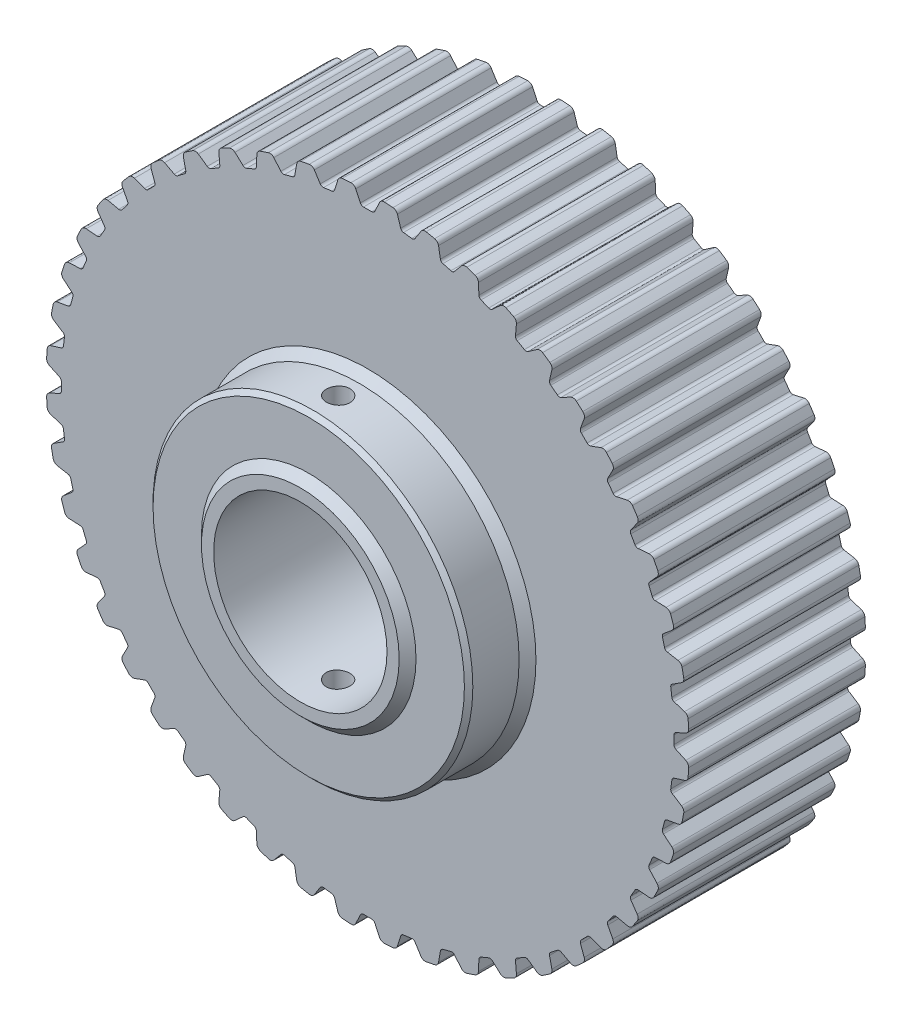
from build123d import *

# Parameters (mm, degrees)
SKETCH1_R                = 38.197185
BOSS_EXTRUDE1_DEPTH      = 21
SKETCH2_R                = 19
BOSS_EXTRUDE2_DEPTH      = 7
SKETCH3_R                = 10.3
CUT_EXTRUDE1_DEPTH       = 61.844472911
CUT_EXTRUDE2_DEPTH       = 58.957310875
FILLET1_R                = 0.4
FILLET2_R                = 0.6
CIRPATTERN1_COUNT        = 48
FILLET1_OF_CIRPATTERN1_R = 0.4
FILLET2_OF_CIRPATTERN1_R = 0.6
BOSS_EXTRUDE3_START      = 1
SKETCH6_R                = 11.75
SKETCH6_R_2              = 10.3
BOSS_EXTRUDE3_DEPTH      = 1
CHAMFER1_SIZE            = 1
CHAMFER2_SIZE            = 1
SKETCH9_R                = 1.4
CUT_EXTRUDE5_DEPTH       = 20
CHAMFER3_SIZE            = 0.5


with BuildPart() as part:
    # Sketch1 → Boss-Extrude1 (new body)
    with BuildSketch(Plane.XY):
        with Locations(Location((0, 0, 0), (0, 0, 180))):
            Circle(SKETCH1_R)
    extrude(amount=BOSS_EXTRUDE1_DEPTH)

    # Sketch2 → Boss-Extrude2 (add)
    with BuildSketch(Plane.XY.offset(21)):
        Circle(SKETCH2_R)
    extrude(amount=BOSS_EXTRUDE2_DEPTH)

    # Sketch3 → Cut-Extrude1 (cut, through all)
    with BuildSketch(Plane.XY.offset(28)):
        Circle(SKETCH3_R)
    extrude(amount=-CUT_EXTRUDE1_DEPTH, mode=Mode.SUBTRACT)

    # Sketch4 → Cut-Extrude2 (cut, through all)
    with BuildSketch(Plane.XY.offset(21)):
        with BuildLine():
            Line((-1.592957441, 38.197185), (-0.75, 36.389456934))
            ThreePointArc((-0.75, 36.389456934), (0, 36.397185), (0.75, 36.389456934))
            Line((0.75, 36.389456934), (1.592957441, 38.197185))
            Line((1.592957441, 38.197185), (-1.592957441, 38.197185))
        make_face()
    cut_extrude2 = extrude(amount=-CUT_EXTRUDE2_DEPTH, mode=Mode.SUBTRACT)

    # Fillet1
    fillet1_edges = [part.edges().sort_by_distance(p)[0] for p in [
        (-0.75, 36.389456934, 10.5),
        (0.75, 36.389456934, 10.5),
    ]]
    fillet(fillet1_edges, radius=FILLET1_R)

    # Fillet2
    fillet2_edges = [part.edges().sort_by_distance(p)[0] for p in [
        (1.577756293, 38.164586032, 10.5),
        (-1.577756293, 38.164586032, 10.5),
    ]]
    fillet(fillet2_edges, radius=FILLET2_R)

    # CirPattern1: Cut-Extrude2 ×48 about axis
    cirpattern1_axis = Axis((0, 0, 0), (0, 0, 1))
    for i in range(1, CIRPATTERN1_COUNT):
        add(cut_extrude2.rotate(cirpattern1_axis, i * 360 / CIRPATTERN1_COUNT), mode=Mode.SUBTRACT)

    # Fillet1 of CirPattern1
    fillet1_of_cirpattern1_edges = [part.edges().sort_by_distance(p)[0] for p in [
        (-5.493360897, 35.980245441, 10.5),
        (-4.006193604, 36.176034729, 10.5),
        (-10.142728865, 34.955401973, 10.5),
        (-8.693840126, 35.343630541, 10.5),
        (-14.618551931, 33.332461886, 10.5),
        (-13.232732632, 33.906487034, 10.5),
        (-18.84424752, 31.139194134, 10.5),
        (-17.545209414, 31.889194134, 10.5),
        (-22.747512809, 28.413126138, 10.5),
        (-21.557482799, 29.326268281, 10.5),
        (-26.261561847, 25.200901676, 10.5),
        (-25.200901676, 26.261561847, 10.5),
        (-29.326268281, 21.557482799, 10.5),
        (-28.413126138, 22.747512809, 10.5),
        (-31.889194134, 17.545209414, 10.5),
        (-31.139194134, 18.84424752, 10.5),
        (-33.906487034, 13.232732632, 10.5),
        (-33.332461886, 14.618551931, 10.5),
        (-35.343630541, 8.693840126, 10.5),
        (-34.955401973, 10.142728865, 10.5),
        (-36.176034729, 4.006193604, 10.5),
        (-35.980245441, 5.493360897, 10.5),
        (-36.389456934, -0.75, 10.5),
        (-36.389456934, 0.75, 10.5),
        (-35.980245441, -5.493360897, 10.5),
        (-36.176034729, -4.006193604, 10.5),
        (-34.955401973, -10.142728865, 10.5),
        (-35.343630541, -8.693840126, 10.5),
        (-33.332461886, -14.618551931, 10.5),
        (-33.906487034, -13.232732632, 10.5),
        (-31.139194134, -18.84424752, 10.5),
        (-31.889194134, -17.545209414, 10.5),
        (-28.413126138, -22.747512809, 10.5),
        (-29.326268281, -21.557482799, 10.5),
        (-25.200901676, -26.261561847, 10.5),
        (-26.261561847, -25.200901676, 10.5),
        (-21.557482799, -29.326268281, 10.5),
        (-22.747512809, -28.413126138, 10.5),
        (-17.545209414, -31.889194134, 10.5),
        (-18.84424752, -31.139194134, 10.5),
        (-13.232732632, -33.906487034, 10.5),
        (-14.618551931, -33.332461886, 10.5),
        (-8.693840126, -35.343630541, 10.5),
        (-10.142728865, -34.955401973, 10.5),
        (-4.006193604, -36.176034729, 10.5),
        (-5.493360897, -35.980245441, 10.5),
        (0.75, -36.389456934, 10.5),
        (-0.75, -36.389456934, 10.5),
        (5.493360897, -35.980245441, 10.5),
        (4.006193604, -36.176034729, 10.5),
        (10.142728865, -34.955401973, 10.5),
        (8.693840126, -35.343630541, 10.5),
        (14.618551931, -33.332461886, 10.5),
        (13.232732632, -33.906487034, 10.5),
        (18.84424752, -31.139194134, 10.5),
        (17.545209414, -31.889194134, 10.5),
        (22.747512809, -28.413126138, 10.5),
        (21.557482799, -29.326268281, 10.5),
        (26.261561847, -25.200901676, 10.5),
        (25.200901676, -26.261561847, 10.5),
        (29.326268281, -21.557482799, 10.5),
        (28.413126138, -22.747512809, 10.5),
        (31.889194134, -17.545209414, 10.5),
        (31.139194134, -18.84424752, 10.5),
        (33.906487034, -13.232732632, 10.5),
        (33.332461886, -14.618551931, 10.5),
        (35.343630541, -8.693840126, 10.5),
        (34.955401973, -10.142728865, 10.5),
        (36.176034729, -4.006193604, 10.5),
        (35.980245441, -5.493360897, 10.5),
        (36.389456934, 0.75, 10.5),
        (36.389456934, -0.75, 10.5),
        (35.980245441, 5.493360897, 10.5),
        (36.176034729, 4.006193604, 10.5),
        (34.955401973, 10.142728865, 10.5),
        (35.343630541, 8.693840126, 10.5),
        (33.332461886, 14.618551931, 10.5),
        (33.906487034, 13.232732632, 10.5),
        (31.139194134, 18.84424752, 10.5),
        (31.889194134, 17.545209414, 10.5),
        (28.413126138, 22.747512809, 10.5),
        (29.326268281, 21.557482799, 10.5),
        (25.200901676, 26.261561847, 10.5),
        (26.261561847, 25.200901676, 10.5),
        (21.557482799, 29.326268281, 10.5),
        (22.747512809, 28.413126138, 10.5),
        (17.545209414, 31.889194134, 10.5),
        (18.84424752, 31.139194134, 10.5),
        (13.232732632, 33.906487034, 10.5),
        (14.618551931, 33.332461886, 10.5),
        (8.693840126, 35.343630541, 10.5),
        (10.142728865, 34.955401973, 10.5),
        (4.006193604, 36.176034729, 10.5),
        (5.493360897, 35.980245441, 10.5),
    ]]
    fillet(fillet1_of_cirpattern1_edges, radius=FILLET1_OF_CIRPATTERN1_R)

    # Fillet2 of CirPattern1
    fillet2_of_cirpattern1_edges = [part.edges().sort_by_distance(p)[0] for p in [
        (-3.417219723, 38.044021229, 10.5),
        (-6.545736461, 37.632144187, 10.5),
        (-8.353726163, 37.272512675, 10.5),
        (-11.401717264, 36.455805921, 10.5),
        (-13.147298031, 35.863261095, 10.5),
        (-16.062611524, 34.655698708, 10.5),
        (-17.715915985, 33.840379175, 10.5),
        (-20.448670047, 32.262622882, 10.5),
        (-21.981409705, 31.238478985, 10.5),
        (-24.484846156, 29.317524634, 10.5),
        (-25.870795411, 28.102079758, 10.5),
        (-28.102079758, 25.870795411, 10.5),
        (-29.317524634, 24.484846156, 10.5),
        (-31.238478985, 21.981409705, 10.5),
        (-32.262622882, 20.448670047, 10.5),
        (-33.840379175, 17.715915985, 10.5),
        (-34.655698708, 16.062611524, 10.5),
        (-35.863261095, 13.147298031, 10.5),
        (-36.455805921, 11.401717264, 10.5),
        (-37.272512675, 8.353726163, 10.5),
        (-37.632144187, 6.545736461, 10.5),
        (-38.044021229, 3.417219723, 10.5),
        (-38.164586032, 1.577756293, 10.5),
        (-38.164586032, -1.577756293, 10.5),
        (-38.044021229, -3.417219723, 10.5),
        (-37.632144187, -6.545736461, 10.5),
        (-37.272512675, -8.353726163, 10.5),
        (-36.455805921, -11.401717264, 10.5),
        (-35.863261095, -13.147298031, 10.5),
        (-34.655698708, -16.062611524, 10.5),
        (-33.840379175, -17.715915985, 10.5),
        (-32.262622882, -20.448670047, 10.5),
        (-31.238478985, -21.981409705, 10.5),
        (-29.317524634, -24.484846156, 10.5),
        (-28.102079758, -25.870795411, 10.5),
        (-25.870795411, -28.102079758, 10.5),
        (-24.484846156, -29.317524634, 10.5),
        (-21.981409705, -31.238478985, 10.5),
        (-20.448670047, -32.262622882, 10.5),
        (-17.715915985, -33.840379175, 10.5),
        (-16.062611524, -34.655698708, 10.5),
        (-13.147298031, -35.863261095, 10.5),
        (-11.401717264, -36.455805921, 10.5),
        (-8.353726163, -37.272512675, 10.5),
        (-6.545736461, -37.632144187, 10.5),
        (-3.417219723, -38.044021229, 10.5),
        (-1.577756293, -38.164586032, 10.5),
        (1.577756293, -38.164586032, 10.5),
        (3.417219723, -38.044021229, 10.5),
        (6.545736461, -37.632144187, 10.5),
        (8.353726163, -37.272512675, 10.5),
        (11.401717264, -36.455805921, 10.5),
        (13.147298031, -35.863261095, 10.5),
        (16.062611524, -34.655698708, 10.5),
        (17.715915985, -33.840379175, 10.5),
        (20.448670047, -32.262622882, 10.5),
        (21.981409705, -31.238478985, 10.5),
        (24.484846156, -29.317524634, 10.5),
        (25.870795411, -28.102079758, 10.5),
        (28.102079758, -25.870795411, 10.5),
        (29.317524634, -24.484846156, 10.5),
        (31.238478985, -21.981409705, 10.5),
        (32.262622882, -20.448670047, 10.5),
        (33.840379175, -17.715915985, 10.5),
        (34.655698708, -16.062611524, 10.5),
        (35.863261095, -13.147298031, 10.5),
        (36.455805921, -11.401717264, 10.5),
        (37.272512675, -8.353726163, 10.5),
        (37.632144187, -6.545736461, 10.5),
        (38.044021229, -3.417219723, 10.5),
        (38.164586032, -1.577756293, 10.5),
        (38.164586032, 1.577756293, 10.5),
        (38.044021229, 3.417219723, 10.5),
        (37.632144187, 6.545736461, 10.5),
        (37.272512675, 8.353726163, 10.5),
        (36.455805921, 11.401717264, 10.5),
        (35.863261095, 13.147298031, 10.5),
        (34.655698708, 16.062611524, 10.5),
        (33.840379175, 17.715915985, 10.5),
        (32.262622882, 20.448670047, 10.5),
        (31.238478985, 21.981409705, 10.5),
        (29.317524634, 24.484846156, 10.5),
        (28.102079758, 25.870795411, 10.5),
        (25.870795411, 28.102079758, 10.5),
        (24.484846156, 29.317524634, 10.5),
        (21.981409705, 31.238478985, 10.5),
        (20.448670047, 32.262622882, 10.5),
        (17.715915985, 33.840379175, 10.5),
        (16.062611524, 34.655698708, 10.5),
        (13.147298031, 35.863261095, 10.5),
        (11.401717264, 36.455805921, 10.5),
        (8.353726163, 37.272512675, 10.5),
        (6.545736461, 37.632144187, 10.5),
        (3.417219723, 38.044021229, 10.5),
    ]]
    fillet(fillet2_of_cirpattern1_edges, radius=FILLET2_OF_CIRPATTERN1_R)

    # Sketch6 → Boss-Extrude3 (add)
    with BuildSketch(Plane.XY.offset(28).offset(BOSS_EXTRUDE3_START)):
        Circle(SKETCH6_R)
        Circle(SKETCH6_R_2, mode=Mode.SUBTRACT)
    extrude(amount=-BOSS_EXTRUDE3_DEPTH)

    # Chamfer1
    chamfer1_edges = [part.edges().sort_by_distance(p)[0] for p in [
        (-11.75, 0, 28),
    ]]
    chamfer(chamfer1_edges, length=CHAMFER1_SIZE - 0.0001)  # a hair under: the kernel refuses the full size

    # Chamfer2
    chamfer2_edges = [part.edges().sort_by_distance(p)[0] for p in [
        (-19, 0, 21),
    ]]
    chamfer(chamfer2_edges, length=CHAMFER2_SIZE)

    # Sketch9 → Cut-Extrude5 (cut, symmetric)
    with BuildSketch(Plane(origin=(0, 0, 0), x_dir=(1, 0, 0), z_dir=(0, 1, 0))):
        with Locations(Location((0, -24.5, 0), (0, 0, 270))):
            Circle(SKETCH9_R)
    extrude(amount=CUT_EXTRUDE5_DEPTH, both=True, mode=Mode.SUBTRACT)

    # Chamfer3
    chamfer3_edges = [part.edges().sort_by_distance(p)[0] for p in [
        (-19, 0, 28),
    ]]
    chamfer(chamfer3_edges, length=CHAMFER3_SIZE)


solid = part.part
